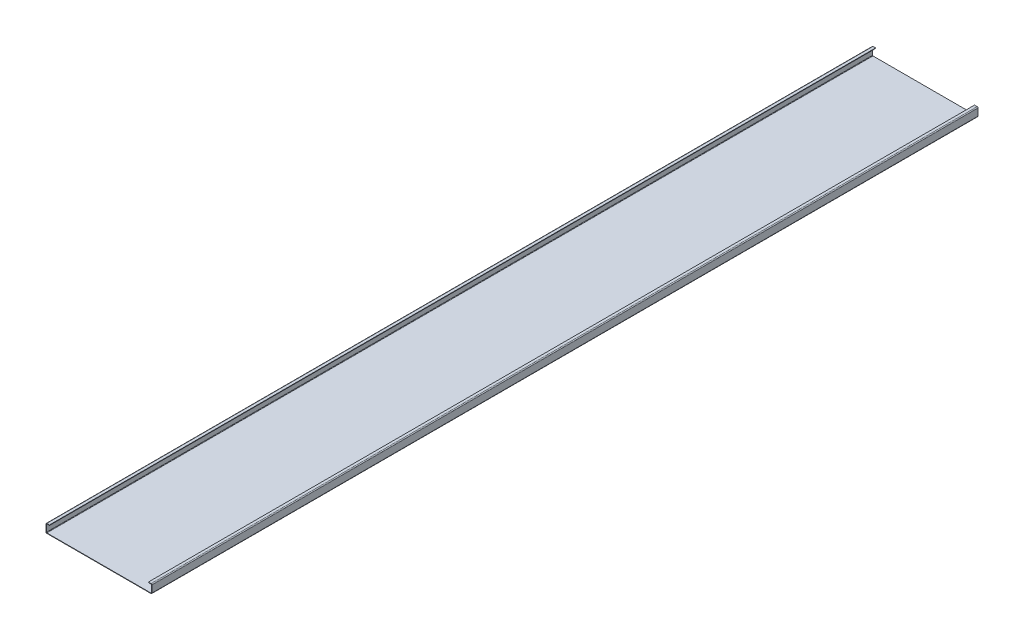
from build123d import *

# Parameters (mm, degrees)
BASE_FLANGE1_DEPTH = 2380


# Sheet-metal steps are written as plain solids
with BuildPart() as part:
    # Sketch1 → Base-Flange1 (new body)
    with BuildSketch(Plane.XY):
        with BuildLine():
            Line((10, 25), (2.5, 25))
            ThreePointArc((2.5, 25), (0.732233047, 24.267766953), (0, 22.5))
            Line((0, 22.5), (0, 2.5))
            ThreePointArc((0, 2.5), (0.732233047, 0.732233047), (2.5, 0))
            Line((2.5, 0), (302.5, 0))
            ThreePointArc((302.5, 0), (304.267766953, 0.732233047), (305, 2.5))
            Line((305, 2.5), (305, 22.5))
            ThreePointArc((305, 22.5), (304.267766953, 24.267766953), (302.5, 25))
            Line((302.5, 25), (295, 25))
            Line((295, 25), (295, 23.75))
            Line((295, 23.75), (302.5, 23.75))
            ThreePointArc((302.5, 23.75), (303.383883476, 23.383883476), (303.75, 22.5))
            Line((303.75, 22.5), (303.75, 2.5))
            ThreePointArc((303.75, 2.5), (303.383883476, 1.616116524), (302.5, 1.25))
            Line((302.5, 1.25), (2.5, 1.25))
            ThreePointArc((2.5, 1.25), (1.616116524, 1.616116524), (1.25, 2.5))
            Line((1.25, 2.5), (1.25, 22.5))
            ThreePointArc((1.25, 22.5), (1.616116524, 23.383883476), (2.5, 23.75))
            Line((2.5, 23.75), (10, 23.75))
            Line((10, 23.75), (10, 25))
        make_face()
    extrude(amount=BASE_FLANGE1_DEPTH)


solid = part.part
